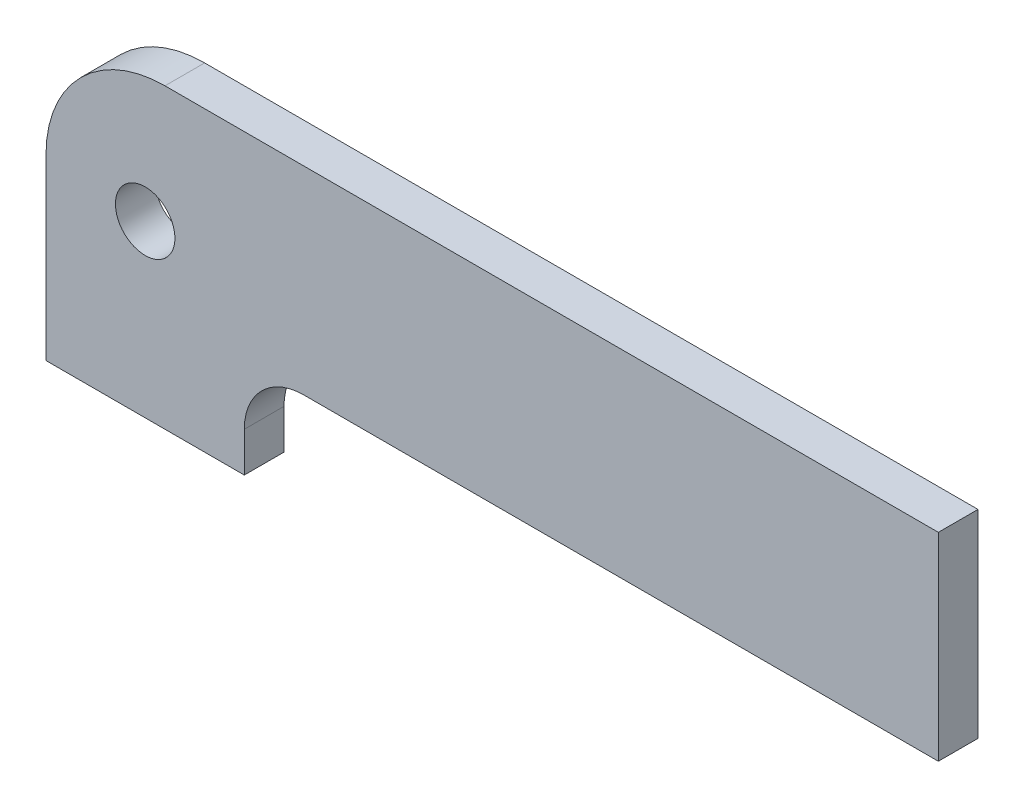
from build123d import *

# Parameters (mm, degrees)
EXTRUDE_1_DEPTH = 2
HOLE_WIZARD_1_D = 3


with BuildPart() as part:
    # 草图1 → 凸台-拉伸1 (new body)
    with BuildSketch(Plane.XY):
        with BuildLine():
            Line((17.5, 5), (-17.5, 5))
            Line((-17.5, 5), (-21.5, 5))
            ThreePointArc((-21.5, 5), (-25.742640687, 3.242640687), (-27.5, -1))
            Line((-27.5, -1), (-27.5, -10))
            Line((-27.5, -10), (-17.5, -10))
            Line((-17.5, -10), (-17.5, -8))
            ThreePointArc((-17.5, -8), (-16.621320344, -5.878679656), (-14.5, -5))
            Line((-14.5, -5), (17.5, -5))
            Line((17.5, -5), (17.5, 5))
        make_face()
    extrude(amount=EXTRUDE_1_DEPTH)

    # 孔1 (through all)
    with Locations(Plane.XY.offset(2)):
        with Locations((-22.498361417, -1.410422078)):
            Hole(HOLE_WIZARD_1_D / 2)


solid = part.part
